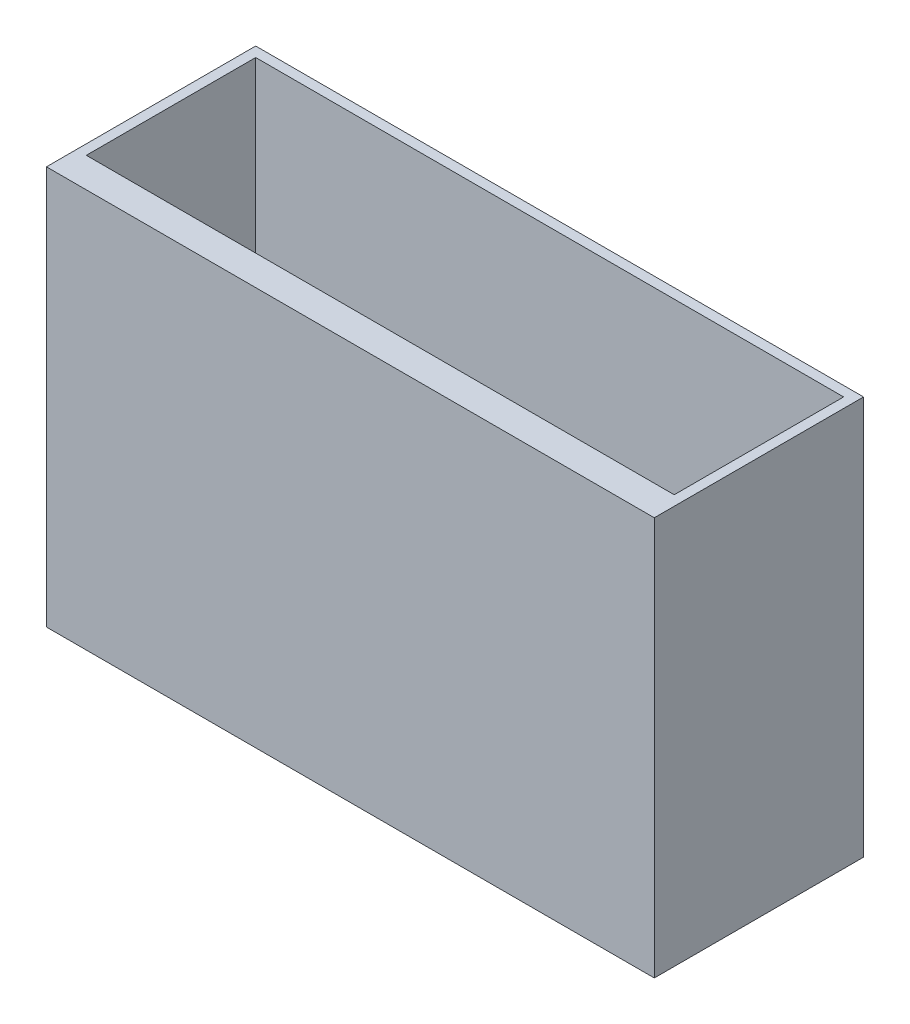
from build123d import *

# Parameters (mm, degrees)
SKETCH1_W           = 30.5
SKETCH1_H           = 10.5
SKETCH1_W_2         = 29.5
SKETCH1_H_2         = 8.5
BOSS_EXTRUDE1_DEPTH = 20


with BuildPart() as part:
    # Sketch1 → Boss-Extrude1 (new body)
    with BuildSketch(Plane(origin=(0, 0, 0), x_dir=(1, 0, 0), z_dir=(0, 1, 0))):
        with Locations((0, -0.5)):
            Rectangle(SKETCH1_W, SKETCH1_H)
        Rectangle(SKETCH1_W_2, SKETCH1_H_2, mode=Mode.SUBTRACT)
    extrude(amount=BOSS_EXTRUDE1_DEPTH)


solid = part.part
